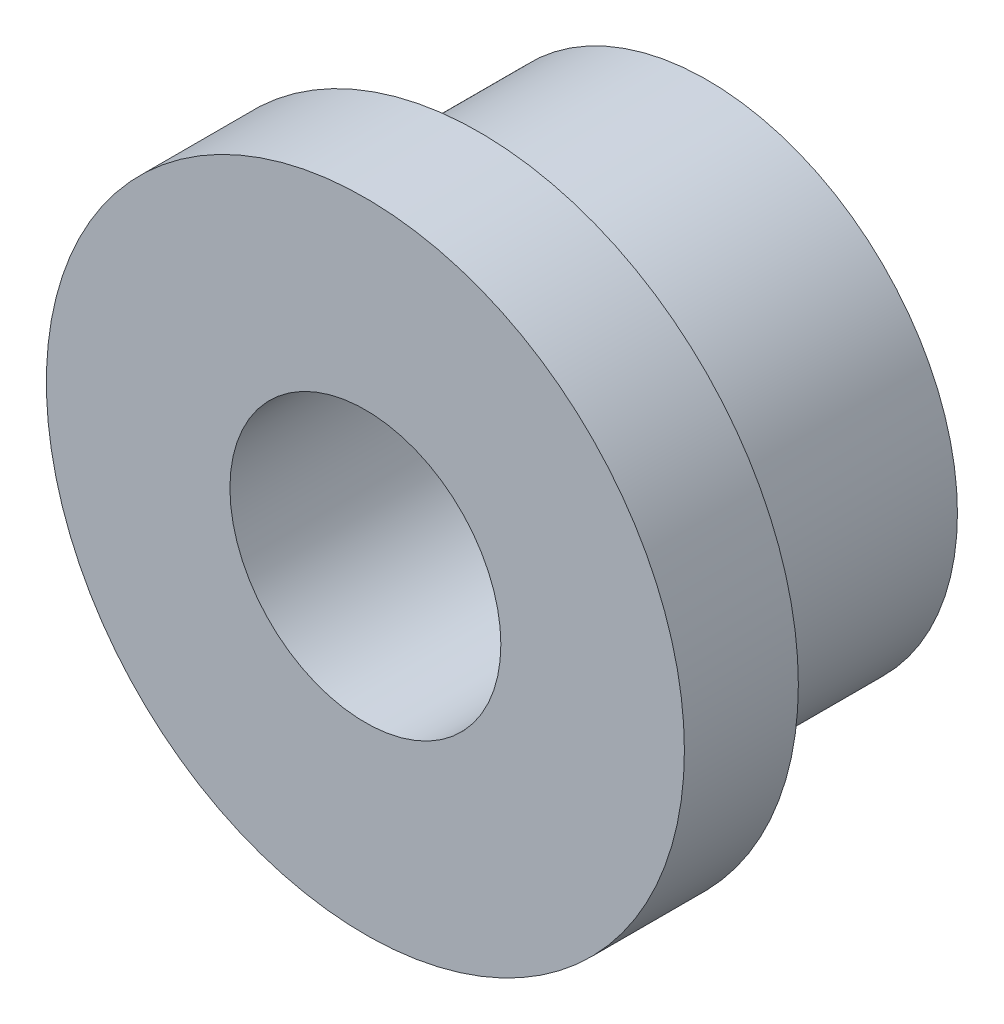
from build123d import *

# Parameters (mm, degrees)
TALADROAVANZADO1_START     = -20
TALADROAVANZADO1_OUTLINE_R = 11.89
TALADROAVANZADO1_DEPTH     = 20


# Read off the part's stored shape, not the designer's step: TaladroAvanzado1
with BuildPart() as part:
    # Croquis1 → Revolución1 (revolve)
    with BuildSketch(Plane(origin=(0, 0, 0), x_dir=(0, 0, -1), z_dir=(1, 0, 0)), mode=Mode.PRIVATE) as revoluci_n1_sk:
        Polygon((0, 0), (0, 28), (10, 28), (10, 21.963), (30, 21.963), (40, 7.5), (40, 0), align=None)
    revolve(revoluci_n1_sk.sketch.rotate(Axis((0, 0, 8.757704884), (0, 0, -1)), 90), axis=Axis((0, 0, 8.757704884), (0, 0, -1)))

    # TaladroAvanzado1 outline → TaladroAvanzado1 (cut)
    with BuildSketch(Plane.XY.offset(TALADROAVANZADO1_START)):
        Circle(TALADROAVANZADO1_OUTLINE_R)
    extrude(amount=TALADROAVANZADO1_DEPTH, mode=Mode.SUBTRACT)


solid = part.part
